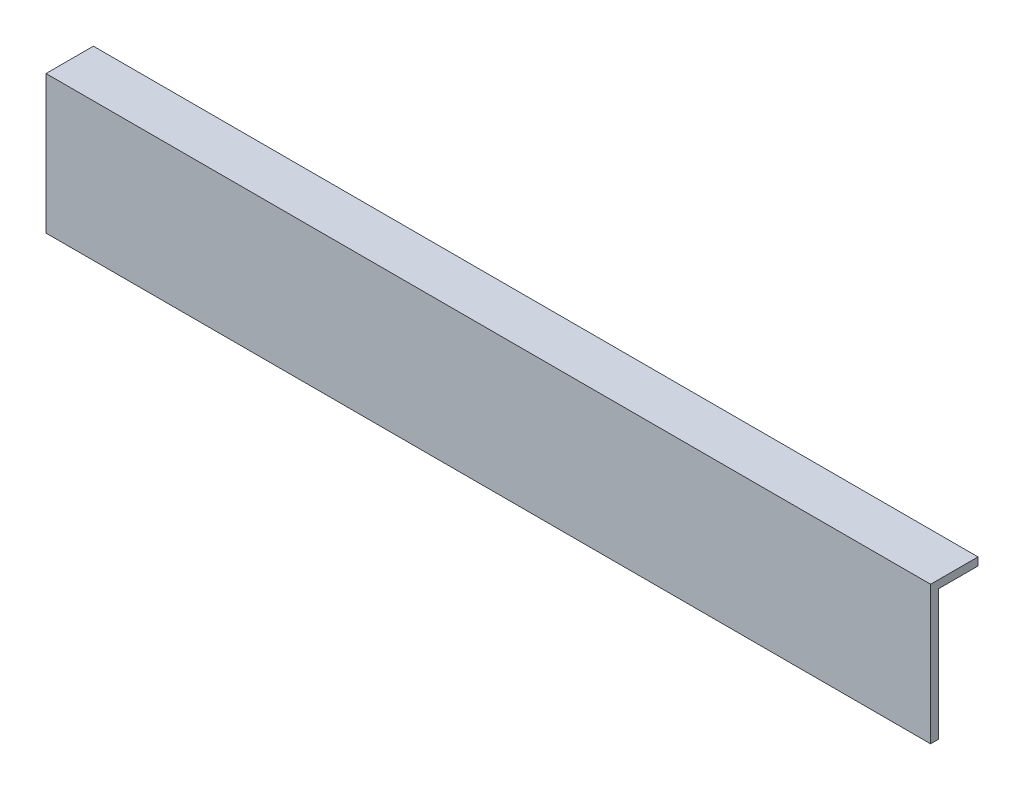
from build123d import *

# Parameters (mm, degrees)
SKETCH1_W           = 448
SKETCH1_H           = 70
BASE_FLANGE1_DEPTH  = 4
SKETCH6_W           = 448
SKETCH6_H           = 4
BOSS_EXTRUDE1_DEPTH = 20


# Sheet-metal steps are written as plain solids
with BuildPart() as part:
    # Sketch1 → Base-Flange1 (new body)
    with BuildSketch(Plane.XY):
        with Locations((0, 35)):
            Rectangle(SKETCH1_W, SKETCH1_H)
    extrude(amount=-BASE_FLANGE1_DEPTH)

    # Sketch6 → Boss-Extrude1 (add)
    with BuildSketch(Plane(origin=(0, 0, -4), x_dir=(-1, 0, 0), z_dir=(0, 0, -1))):
        with Locations((0, 68)):
            Rectangle(SKETCH6_W, SKETCH6_H)
    extrude(amount=BOSS_EXTRUDE1_DEPTH)


solid = part.part
